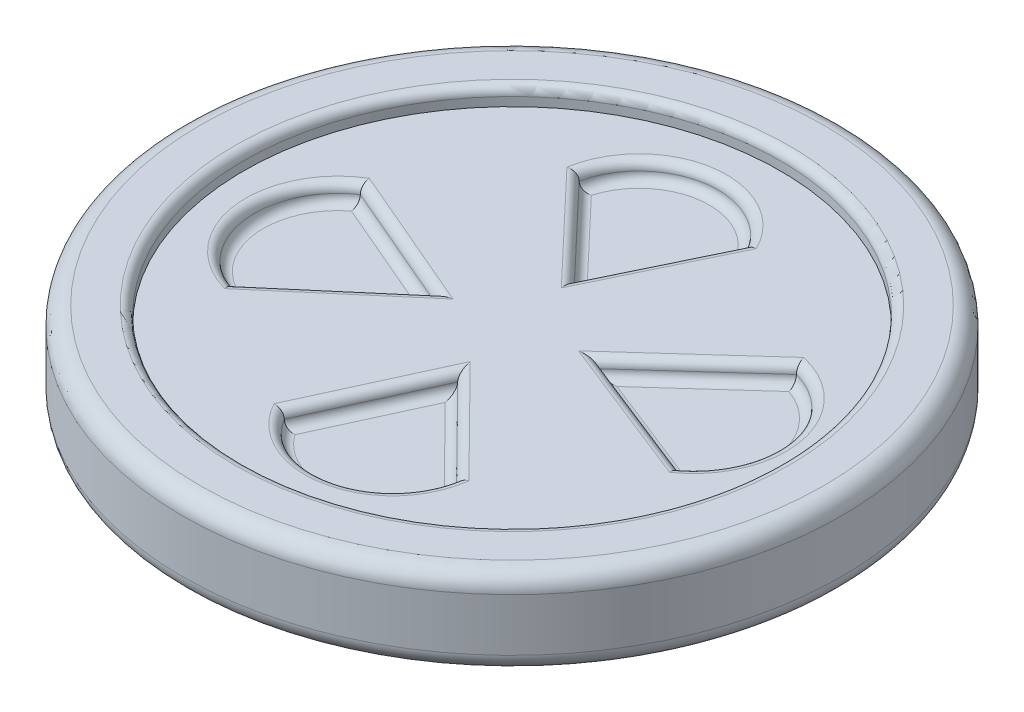
from build123d import *

# Parameters (mm, degrees)
SKETCH1_R           = 37.630353996
BOSS_EXTRUDE1_DEPTH = 10
FILLET2_R           = 2
FILLET3_R           = 2
SKETCH2_R           = 30.630353996
CUT_EXTRUDE1_DEPTH  = 2
FILLET4_R           = 1
CUT_EXTRUDE4_DEPTH  = 2
FILLET5_R           = 1


with BuildPart() as part:
    # Sketch1 → Boss-Extrude1 (new body)
    with BuildSketch(Plane(origin=(0, 0, 0), x_dir=(1, 0, 0), z_dir=(0, 1, 0))):
        with Locations(Location((-29.877921898, 24.882755633, 0), (0, 0, 270))):
            Circle(SKETCH1_R)
    extrude(amount=BOSS_EXTRUDE1_DEPTH)

    # Fillet2
    fillet2_edges = [part.edges().sort_by_distance(p)[0] for p in [
        (-29.877921898, 10, -62.513109628),
    ]]
    fillet(fillet2_edges, radius=FILLET2_R)

    # Fillet3
    fillet3_edges = [part.edges().sort_by_distance(p)[0] for p in [
        (-29.877921898, 0, -62.513109628),
    ]]
    fillet(fillet3_edges, radius=FILLET3_R)

    # Sketch2 → Cut-Extrude1 (cut)
    with BuildSketch(Plane(origin=(0, 10, 0), x_dir=(1, 0, 0), z_dir=(0, 1, 0))):
        with Locations(Location((-29.877921898, 24.882755633, 0), (0, 0, 270))):
            Circle(SKETCH2_R)
    extrude(amount=-CUT_EXTRUDE1_DEPTH, mode=Mode.SUBTRACT)

    # Fillet4
    fillet4_edges = [part.edges().sort_by_distance(p)[0] for p in [
        (-29.877921898, 10, -55.513109628),
    ]]
    fillet(fillet4_edges, radius=FILLET4_R)

    # Sketch8 → Cut-Extrude4 (cut)
    with BuildSketch(Plane(origin=(0, 8, 0), x_dir=(1, 0, 0), z_dir=(0, 1, 0))):
        with BuildLine():
            Line((-41.341331235, 44.013355539), (-31.064753216, 33.170874924))
            Line((-31.064753216, 33.170874924), (-24.663948135, 46.43305374))
            ThreePointArc((-24.663948135, 46.43305374), (-33.837706119, 50.978766565), (-41.341331235, 44.013355539))
        make_face()
        with BuildLine():
            Line((-18.059542281, 6.737272878), (-28.409671492, 17.21250643))
            Line((-28.409671492, 17.21250643), (-34.621977315, 3.626679329))
            ThreePointArc((-34.621977315, 3.626679329), (-25.267257218, -0.533915887), (-18.059542281, 6.737272878))
        make_face()
        with BuildLine():
            Line((-50.185746084, 13.251976063), (-37.747922577, 23.858904665))
            Line((-37.747922577, 23.858904665), (-52.505778259, 30.187416349))
            ThreePointArc((-52.505778259, 30.187416349), (-56.60295046, 20.999499638), (-50.185746084, 13.251976063))
        make_face()
        with BuildLine():
            Line((-9.812756735, 37.290489651), (-21.726502131, 26.524476689))
            Line((-21.726502131, 26.524476689), (-6.524310314, 20.51616978))
            ThreePointArc((-6.524310314, 20.51616978), (-2.961361081, 29.924146518), (-9.812756735, 37.290489651))
        make_face()
    extrude(amount=-CUT_EXTRUDE4_DEPTH, mode=Mode.SUBTRACT)

    # Fillet5
    fillet5_edges = [part.edges().sort_by_distance(p)[0] for p in [
        (-45.126850418, 6, -27.023160507),
        (-27.864350675, 6, -39.801964332),
        (-2.961361081, 6, -29.924146518),
        (-23.234606887, 6, -11.974889654),
        (-2.961361081, 8, -29.924146518),
        (-15.769629433, 6, -31.90748317),
        (-15.769629433, 8, -31.90748317),
        (-14.125406223, 6, -23.520323235),
        (-14.125406223, 8, -23.520323235),
        (-23.234606887, 8, -11.974889654),
        (-31.515824404, 6, -10.419592879),
        (-25.267257218, 6, 0.533915887),
        (-25.267257218, 8, 0.533915887),
        (-31.515824404, 8, -10.419592879),
        (-56.60295046, 6, -20.999499638),
        (-33.837706119, 6, -50.978766565),
        (-36.203042226, 6, -38.592115231),
        (-27.864350675, 8, -39.801964332),
        (-33.837706119, 8, -50.978766565),
        (-36.203042226, 8, -38.592115231),
        (-45.126850418, 8, -27.023160507),
        (-43.96683433, 8, -18.555440364),
        (-56.60295046, 8, -20.999499638),
    ]]
    fillet(fillet5_edges, radius=FILLET5_R - 0.0001)  # a hair under: the kernel refuses the full size


solid = part.part
